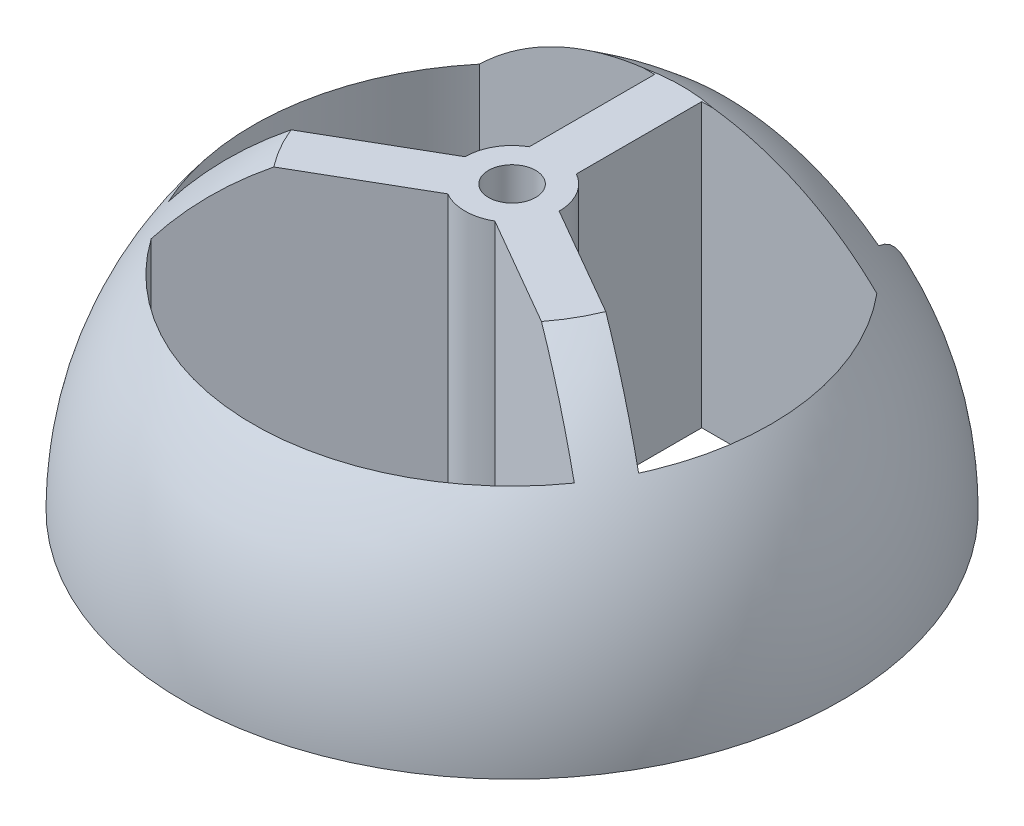
from build123d import *

# Parameters (mm, degrees)
SKETCH4_R                = 11
CUT_EXTRUDE4_DEPTH       = 25.24871130596428
CUT_EXTRUDE5_DEPTH       = 22.61018278497431
BOSS_EXTRUDE1_REACH      = 23.61
BOSS_EXTRUDE1_END_RADIUS = 14
SKETCH5_R                = 1
CUT_EXTRUDE6_DEPTH       = 25.228082936808025
CUT_EXTRUDE6_DEPTH_BACK  = 25.228082936808025
SKETCH7_W                = 20.71331496786042
SKETCH7_H                = 3.3753478844387406


with BuildPart() as part:
    # Sketch1 → Revolve1 (revolve)
    with BuildSketch(Plane.XY):
        with BuildLine():
            Line((0, 14), (0, 0))
            Line((0, 0), (14, 0))
            ThreePointArc((14, 0), (9.899494936611665, 9.899494936611664), (0, 14))
        make_face()
    revolve(axis=Axis((2.58857e-12, -754.6294122675524, 0), (-3.43e-15, 1, 0)))

    # Sketch4 → Cut-Extrude4 (cut, through all)
    with BuildSketch(Plane(origin=(0, 0, 0), x_dir=(1, 0, 0), z_dir=(0, 1, 0))):
        Circle(SKETCH4_R)
    extrude(amount=CUT_EXTRUDE4_DEPTH, mode=Mode.SUBTRACT)

    # Sketch6 → Cut-Extrude5 (cut, through all)
    with BuildSketch(Plane(origin=(0, 0, 0), x_dir=(1, 0, 0), z_dir=(0, 1, 0))):
        with BuildLine():
            Line((-6.517247173666797, 9.056407864998738), (6.517247173666797, 9.056407864998738))
            Line((6.517247173666797, 9.056407864998738), (3.999999999999999, 13.41640786499874))
            ThreePointArc((3.999999999999999, 13.41640786499874), (8.6e-16, 14.000000000000004), (-4.000000000000003, 13.41640786499874))
            Line((-4.000000000000003, 13.41640786499874), (-6.517247173666797, 9.056407864998738))
        make_face()
    extrude(amount=CUT_EXTRUDE5_DEPTH, mode=Mode.SUBTRACT)

    # Boss-Extrude1: up to this sphere (the profile starts inside it)
    boss_extrude1_end = Location((0, 0, 0)) * Sphere(BOSS_EXTRUDE1_END_RADIUS, mode=Mode.PRIVATE)
    # Sketch5 → Boss-Extrude1 (add, up to the surface)
    with BuildSketch(Plane(origin=(0, 0, 0), x_dir=(1, 0, 0), z_dir=(0, 1, 0)), mode=Mode.PRIVATE) as boss_extrude1_sk1:
        with BuildLine():
            Line((-8.438430425309198, 7.0564078649987385), (-1, 7.0564078649987385))
            Line((-1, 7.0564078649987385), (-1.0000000000000004, 1.7320508075688774))
            ThreePointArc((-1.0000000000000004, 1.7320508075688774), (-1.7320508075688774, 0.9999999999999999), (-2, 5.4e-16))
            Line((-2, 5.4e-16), (-12.593386622447841, -6.11609461810001))
            Line((-12.593386622447841, -6.11609461810001), (-11.593386622447845, -7.848145425668888))
            Line((-11.593386622447845, -7.848145425668888), (-1.0000000000000013, -1.7320508075688765))
            ThreePointArc((-1.0000000000000013, -1.7320508075688765), (1.9e-15, -2), (1.0000000000000044, -1.7320508075688748))
            Line((1.0000000000000044, -1.7320508075688748), (11.593386622447845, -7.848145425668888))
            Line((11.593386622447845, -7.848145425668888), (12.593386622447841, -6.11609461810001))
            Line((12.593386622447841, -6.11609461810001), (2, 3.9e-15))
            ThreePointArc((2, 3.9e-15), (1.7320508075688767, 1.0000000000000018), (1.0000000000000004, 1.7320508075688774))
            Line((1.0000000000000004, 1.7320508075688774), (1, 7.0564078649987385))
            Line((1, 7.0564078649987385), (8.438430425309198, 7.0564078649987385))
            Line((8.438430425309198, 7.0564078649987385), (8.438430425309198, 9.056407864998738))
            Line((8.438430425309198, 9.056407864998738), (-8.438430425309198, 9.056407864998738))
            Line((-8.438430425309198, 9.056407864998738), (-8.438430425309198, 7.0564078649987385))
        make_face()
        Circle(SKETCH5_R, mode=Mode.SUBTRACT)
    boss_extrude1_tool1 = extrude(boss_extrude1_sk1.sketch, amount=BOSS_EXTRUDE1_REACH, mode=Mode.PRIVATE) & boss_extrude1_end
    add(boss_extrude1_tool1.solids().sort_by_distance((0, 0, -1.246464))[0])

    # Sketch7 → Cut-Extrude6 (cut, two sides: drawn at the far end of the back side and taken through both)
    with BuildSketch(Plane.XY.offset(-CUT_EXTRUDE6_DEPTH_BACK)):
        with Locations((0.3773680864589952, 13.687673942219323)):
            Rectangle(SKETCH7_W, SKETCH7_H)
    extrude(amount=CUT_EXTRUDE6_DEPTH + CUT_EXTRUDE6_DEPTH_BACK, mode=Mode.SUBTRACT)


solid = part.part
